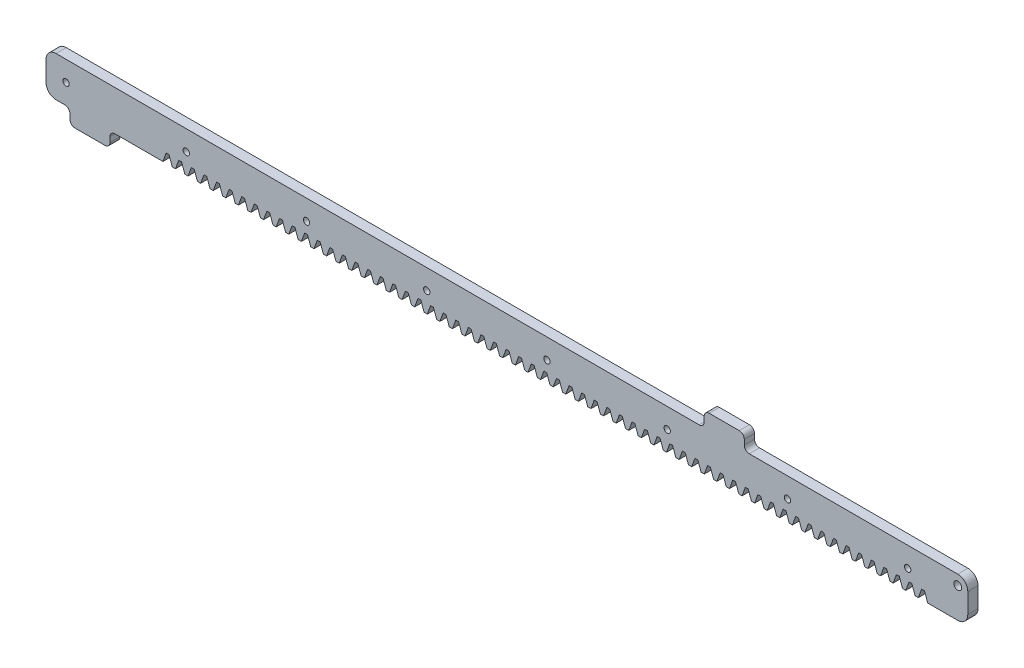
from build123d import *

# Parameters (mm, degrees)
SKETCH1_R           = 2.4892
BOSS_EXTRUDE1_DEPTH = 6.477
FILLET2_R           = 6.35
CUT_EXTRUDE1_DEPTH  = 586.278862726
LPATTERN1_COUNT     = 61
LPATTERN1_PITCH     = 7.979645331
SKETCH3_R           = 2.0193
CUT_EXTRUDE2_DEPTH  = 586.278862726
LPATTERN2_COUNT     = 8
LPATTERN2_PITCH     = 76.2
FILLET3_R           = 3.175


with BuildPart() as part:
    # Sketch1 → Boss-Extrude1 (new body)
    with BuildSketch(Plane.XY):
        Polygon((0, 25.4), (0, 0), (15.13078, 0), (15.13078, -9.525), (40.53078, -9.525), (40.53078, 0), (584.2, 0), (584.2, 25.4), (533.4, 25.4), (442.540898, 25.4), (442.540898, 34.925), (417.140898, 34.925), (417.140898, 25.4), (40.53078, 25.4), align=None)
        with Locations((577.85, 19.05)):
            Circle(SKETCH1_R, mode=Mode.SUBTRACT)
    extrude(amount=BOSS_EXTRUDE1_DEPTH)

    # Fillet2
    fillet2_edges = [part.edges().sort_by_distance(p)[0] for p in [
        (0, 0, 3.2385),
        (0, 25.4, 3.2385),
        (584.2, 25.4, 3.2385),
        (584.2, 0, 3.2385),
    ]]
    fillet(fillet2_edges, radius=FILLET2_R)

    # Sketch2 → Cut-Extrude1 (cut, through all)
    with BuildSketch(Plane.XY.offset(6.477)):
        Polygon((552.86876001, 0), (558.8, 0), (556.719910111, 5.715), (554.948849899, 5.715), align=None)
    cut_extrude1 = extrude(amount=-CUT_EXTRUDE1_DEPTH, mode=Mode.SUBTRACT)

    # LPattern1: Cut-Extrude1 ×61
    with Locations(*[(-i * LPATTERN1_PITCH, 0, 0) for i in range(1, LPATTERN1_COUNT)]):
        add(cut_extrude1, mode=Mode.SUBTRACT)

    # Sketch3 → Cut-Extrude2 (cut, through all)
    with BuildSketch(Plane.XY.offset(6.477)):
        with Locations((546.1, 12.7)):
            Circle(SKETCH3_R)
    cut_extrude2 = extrude(amount=-CUT_EXTRUDE2_DEPTH, mode=Mode.SUBTRACT)

    # LPattern2: Cut-Extrude2 ×8
    with Locations(*[(-i * LPATTERN2_PITCH, 0, 0) for i in range(1, LPATTERN2_COUNT)]):
        add(cut_extrude2, mode=Mode.SUBTRACT)

    # Fillet3
    fillet3_edges = [part.edges().sort_by_distance(p)[0] for p in [
        (417.140898, 25.4, 3.2385),
        (417.140898, 34.925, 3.2385),
        (442.540898, 34.925, 3.2385),
        (442.540898, 25.4, 3.2385),
        (40.53078, -9.525, 3.2385),
        (40.53078, 0, 3.2385),
        (15.13078, -9.525, 3.2385),
        (15.13078, 0, 3.2385),
    ]]
    fillet(fillet3_edges, radius=FILLET3_R)


solid = part.part
